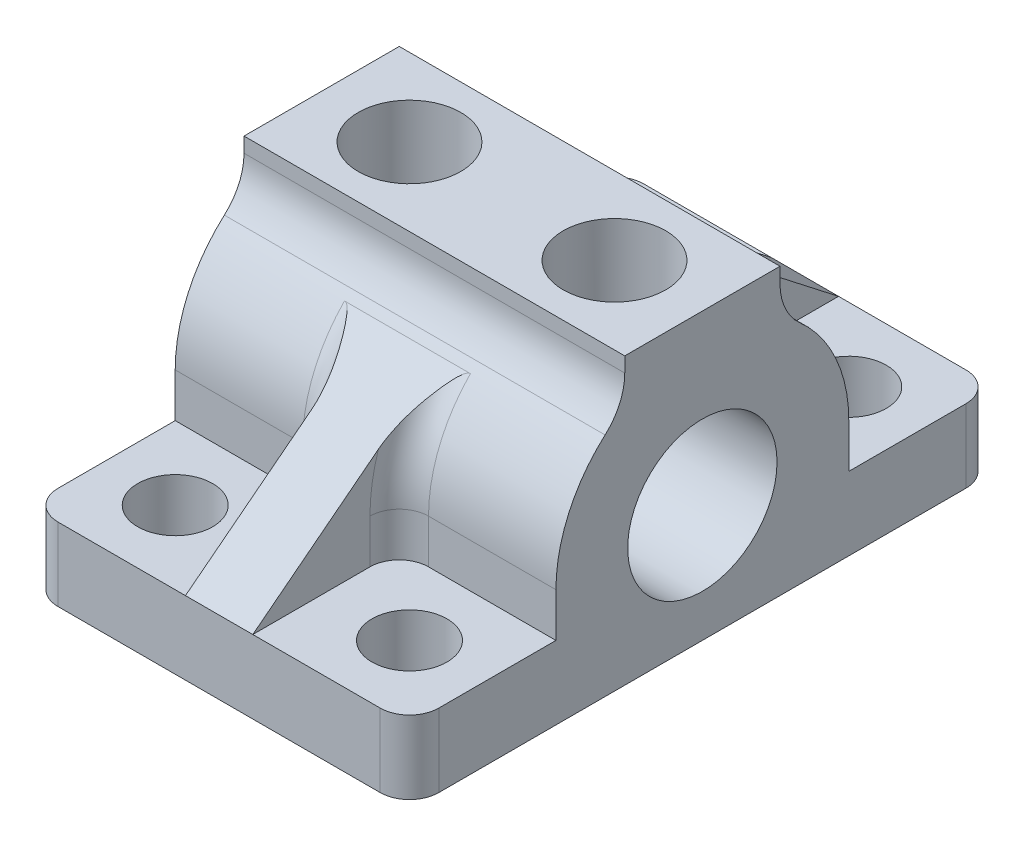
from build123d import *

# Parameters (mm, degrees)
SKETCH1_R           = 3.2385
BOSS_EXTRUDE1_DEPTH = 8.255
BOSS_EXTRUDE2_DEPTH = 1.4605
SKETCH3_R           = 1.6256
CUT_EXTRUDE1_DEPTH  = 18.250508688
CUT_EXTRUDE2_DEPTH  = 42.211451079
SKETCH6_W           = 16.51
SKETCH6_H           = 6.731
BOSS_EXTRUDE3_DEPTH = 1.905
SKETCH5_R           = 2.2225
CUT_EXTRUDE3_DEPTH  = 6.35
FILLET1_R           = 1.27
FILLET2_R           = 2.54


with BuildPart() as part:
    # Sketch1 → Boss-Extrude1 (new, symmetric)
    with BuildSketch(Plane(origin=(0, 0, 0), x_dir=(0, 0, -1), z_dir=(1, 0, 0))):
        with BuildLine():
            Line((12.7, 24.13), (-12.7, 24.13))
            Line((-12.7, 24.13), (-12.7, 27.305))
            Line((-12.7, 27.305), (-6.35, 27.305))
            Line((-6.35, 27.305), (-6.35, 29.21))
            ThreePointArc((-6.35, 29.21), (0, 35.56), (6.35, 29.21))
            Line((6.35, 29.21), (6.35, 27.305))
            Line((6.35, 27.305), (12.7, 27.305))
            Line((12.7, 27.305), (12.7, 24.13))
        make_face()
        with Locations((0, 29.21)):
            Circle(SKETCH1_R, mode=Mode.SUBTRACT)
    extrude(amount=BOSS_EXTRUDE1_DEPTH, both=True)

    # Sketch2 → Boss-Extrude2 (add, symmetric)
    with BuildSketch(Plane(origin=(0, 0, 0), x_dir=(0, 0, -1), z_dir=(1, 0, 0))):
        Polygon((-4.534807052, 33.655), (-12.7, 27.305), (-4.534807052, 27.305), align=None)
        Polygon((4.534807052, 27.305), (4.534807052, 33.655), (12.7, 27.305), align=None)
    extrude(amount=BOSS_EXTRUDE2_DEPTH, both=True)

    # Sketch3 → Cut-Extrude1 (cut, through all)
    with BuildSketch(Plane(origin=(0, 27.305, 0), x_dir=(1, 0, 0), z_dir=(0, 1, 0))):
        with Locations((-5.08, 9.525)):
            Circle(SKETCH3_R)
        with Locations((5.08, 9.525)):
            Circle(SKETCH3_R)
        with Locations((5.08, -9.525)):
            Circle(SKETCH3_R)
        with Locations((-5.08, -9.525)):
            Circle(SKETCH3_R)
    extrude(amount=-CUT_EXTRUDE1_DEPTH, mode=Mode.SUBTRACT)

    # Sketch4 → Cut-Extrude2 (cut, through all)
    with BuildSketch(Plane(origin=(8.255, 0, 0), x_dir=(0, 0, -1), z_dir=(1, 0, 0))):
        with BuildLine():
            Line((3.3655, 34.594785024), (-3.3655, 34.594785024))
            ThreePointArc((-3.3655, 34.594785024), (0, 35.56), (3.3655, 34.594785024))
        make_face()
    extrude(amount=-CUT_EXTRUDE2_DEPTH, mode=Mode.SUBTRACT)

    # Sketch6 → Boss-Extrude3 (add)
    with BuildSketch(Plane(origin=(0, 34.594785024, 0), x_dir=(1, 0, 0), z_dir=(0, 1, 0))):
        Rectangle(SKETCH6_W, SKETCH6_H)
    extrude(amount=BOSS_EXTRUDE3_DEPTH)

    # Sketch5 → Cut-Extrude3 (cut)
    with BuildSketch(Plane(origin=(0, 36.499785024, 0), x_dir=(1, 0, 0), z_dir=(0, 1, 0))):
        with Locations((-4.445, 0)):
            Circle(SKETCH5_R)
        with Locations((4.445, 0)):
            Circle(SKETCH5_R)
    extrude(amount=-CUT_EXTRUDE3_DEPTH, mode=Mode.SUBTRACT)

    # Fillet1
    fillet1_edges = [part.edges().sort_by_distance(p)[0] for p in [
        (-1.4605, 31.610674407, 5.878712647),
        (1.4605, 31.610674407, 5.878712647),
        (-1.4605, 31.610674407, -5.878712647),
        (1.4605, 31.610674407, -5.878712647),
        (-1.4605, 28.2575, 6.35),
        (1.4605, 28.2575, 6.35),
        (-1.4605, 28.2575, -6.35),
        (1.4605, 28.2575, -6.35),
        (-8.255, 25.7175, -12.7),
        (8.255, 25.7175, -12.7),
        (-8.255, 25.7175, 12.7),
        (8.255, 25.7175, 12.7),
    ]]
    fillet(fillet1_edges, radius=FILLET1_R)

    # Fillet2
    fillet2_edges = [part.edges().sort_by_distance(p)[0] for p in [
        (0, 34.594785024, -3.3655),
        (0, 34.594785024, 3.3655),
    ]]
    fillet(fillet2_edges, radius=FILLET2_R)


solid = part.part
